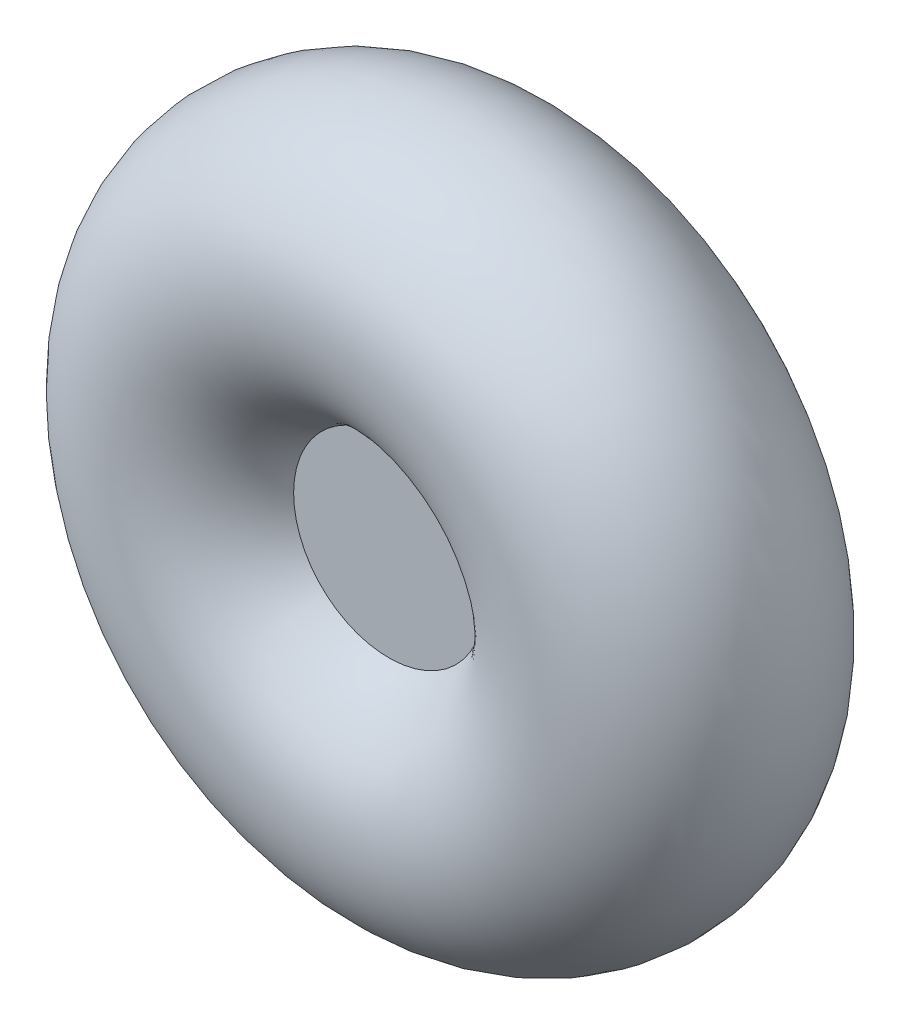
from build123d import *


with BuildPart() as part:
    # Sketch1 → Revolve1 (revolve)
    with BuildSketch(Plane(origin=(0, 0, 0), x_dir=(0, 0, -1), z_dir=(1, 0, 0))):
        with BuildLine():
            Line((-9.502901594, 14.745980598), (-9.502901594, 0))
            Line((-9.502901594, 0), (9.502901594, 0))
            Line((9.502901594, 0), (9.502901594, 14.745980598))
            ThreePointArc((9.502901594, 14.745980598), (0, 53.975), (-9.502901594, 14.745980598))
        make_face()
    revolve(axis=Axis((0, 0, 0), (0, 0, 1)))


solid = part.part
